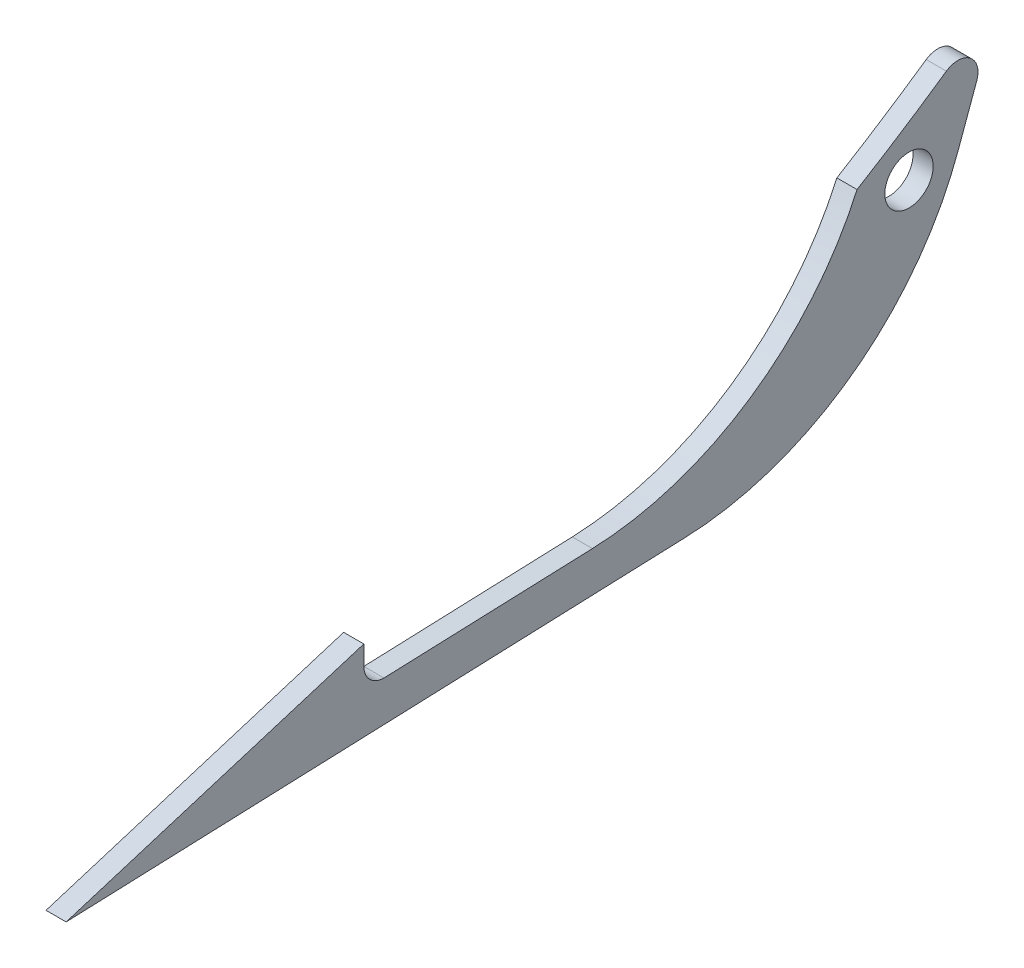
from build123d import *

# Parameters (mm, degrees)
SKETCH_1_R          = 6
EXTRUDE_1_DEPTH     = 5
FILLET_1_R          = 5
FILLET_2_R          = 75
FILLET_3_R          = 5
EXTRUDE_2_DEPTH     = 5
CUT_EXTRUDE_2_DEPTH = 160.415234704


with BuildPart() as part:
    # Эскиз1 → Бобышка-Вытянуть1 (new body)
    with BuildSketch(Plane(origin=(0, 0, 0), x_dir=(0, 0, -1), z_dir=(1, 0, 0))):
        with BuildLine():
            Line((126.237664014, 58.886284382), (98.821729218, -16.438377404))
            Line((98.821729218, -16.438377404), (-151.178270782, -25.884067346))
            Line((-151.178270782, -25.884067346), (-77.345590471, -3.080194644))
            Line((-77.345590471, -3.080194644), (-77.345590471, -13.087329783))
            Line((-77.345590471, -13.087329783), (75.539410437, -7.310912522))
            Line((75.539410437, -7.310912522), (90.975731778, 35.100031802))
            ThreePointArc((90.975731778, 35.100031802), (108.905022115, 46.550907327), (126.237664014, 58.886284382))
        make_face()
        with Locations((103.870185422, 30.698515365)):
            Circle(SKETCH_1_R, mode=Mode.SUBTRACT)
    extrude(amount=EXTRUDE_1_DEPTH)

    # Скругление1
    fillet_1_edges = [part.edges().sort_by_distance(p)[0] for p in [
        (2.5, -13.087329783, 77.345590471),
    ]]
    fillet(fillet_1_edges, radius=FILLET_1_R)

    # Скругление2
    # the kernel refuses this fillet: 75 mm, written as the material it adds along each edge
    with BuildSketch(Plane(origin=(0, -7.310912522, -75.539410437), x_dir=(0, -0.037755820465347284, 0.9992869948223027), z_dir=(1, 0, 0))) as fillet_2_piece_1:
        with BuildLine():
            CenterArc((50.223853574, -75), FILLET_2_R, 90, 63.724056715)
            Line((-17.026575163, -41.797894123), (0, 0))
            Line((0, 0), (50.223853574, 0))
        make_face()
    extrude(amount=5)
    # the kernel refuses this fillet: 75 mm, written as the material it takes off along each edge
    with BuildSketch(Plane(origin=(-126.080854452, -16.438377404, -98.821729218), x_dir=(0, -0.03775582046534733, 0.9992869948223025), z_dir=(1, 0, 0))) as fillet_2_2_piece_1:
        with BuildLine():
            CenterArc((FILLET_2_R * 0.672431223743, -FILLET_2_R), FILLET_2_R, 90, 67.836236553)
            Line((-FILLET_2_R * 0.253678140212, -FILLET_2_R * 0.622744852924), (0, 0))
            Line((0, 0), (FILLET_2_R * 0.672431223743, 0))
        make_face()
    extrude(amount=257.161708904, mode=Mode.SUBTRACT)

    # Скругление3
    fillet_3_edges = [part.edges().sort_by_distance(p)[0] for p in [
        (2.5, 58.886284382, -126.237664014),
    ]]
    fillet(fillet_3_edges, radius=FILLET_3_R)

    # Эскиз4 → Бобышка-Вытянуть2 (add)
    with BuildSketch(Plane(origin=(5, 0, 0), x_dir=(0, 0, -1), z_dir=(1, 0, 0))):
        with BuildLine():
            Line((-105.187577254, -24.146412021), (-31.354896943, -1.342539319))
            Line((-31.354896943, -1.342539319), (-31.354896943, -6.15719309))
            ThreePointArc((-31.354896943, -6.15719309), (-29.890430849, -9.692726996), (-26.354896943, -11.15719309))
            Line((-26.354896943, -11.15719309), (-31.354896943, -21.356809597))
            Line((-31.354896943, -21.356809597), (-105.187577254, -24.146412021))
        make_face()
    extrude(amount=-EXTRUDE_2_DEPTH)

    # Эскиз5 → Вырез-Вытянуть2 (cut, through all)
    with BuildSketch(Plane(origin=(5, 0, 0), x_dir=(0, 0, -1), z_dir=(1, 0, 0))):
        Polygon((-38.471521652, -3.540571454), (-146.983243384, -37.055371114), (-175.325798577, -14.870573448), (-65.732340229, 27.748343591), align=None)
    extrude(amount=-CUT_EXTRUDE_2_DEPTH, mode=Mode.SUBTRACT)


solid = part.part
